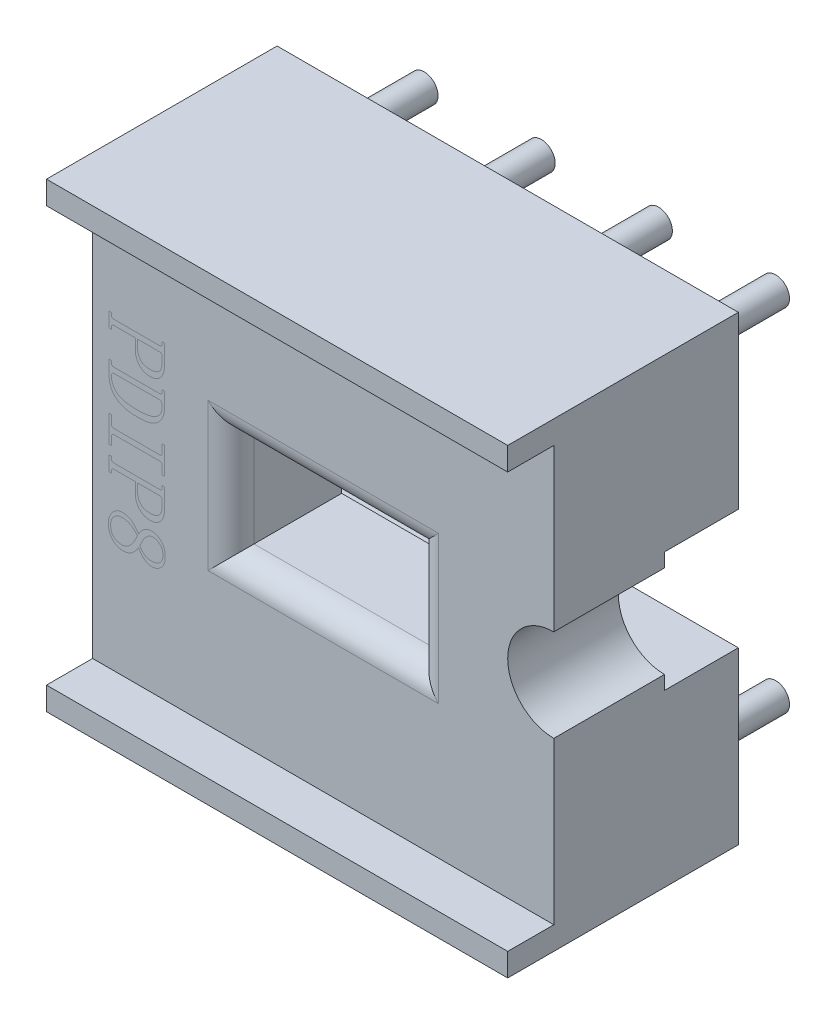
from build123d import *

# Parameters (mm, degrees)
EXTRUDE_1_DEPTH     = 5
SKETCH_2_W          = 1
SKETCH_2_H          = 9
SKETCH_2_W_2        = 1.6
SKETCH_2_H_2        = 2.6
CUT_EXTRUDE_1_DEPTH = 16
CUT_EXTRUDE_2_REACH = 16.697
SKETCH_3_W          = 4
SKETCH_3_H          = 2.2
SKETCH_4_R          = 0.3
EXTRUDE_2_DEPTH     = 2
FILLET_1_R          = 0.5


with BuildPart() as part:
    # 草图1 → 凸台-拉伸1 (new body)
    with BuildSketch(Plane.XY):
        with BuildLine():
            Line((0, 0), (10, 0))
            Line((10, 0), (10, 4))
            ThreePointArc((10, 4), (9, 5), (10, 6))
            Line((10, 6), (10, 10))
            Line((10, 10), (0, 10))
            Line((0, 10), (0, 0))
        make_face()
    extrude(amount=EXTRUDE_1_DEPTH)

    # 草图2 → 切除-拉伸1 (cut, through all)
    with BuildSketch(Plane(origin=(10, 0, 0), x_dir=(0, 0, -1), z_dir=(1, 0, 0))):
        with Locations((-4.5, 5)):
            Rectangle(SKETCH_2_W, SKETCH_2_H)
        with Locations((-0.8, 5)):
            Rectangle(SKETCH_2_W_2, SKETCH_2_H_2)
    extrude(amount=-CUT_EXTRUDE_1_DEPTH, mode=Mode.SUBTRACT)

    # 草图3 → 切除-拉伸2 (cut, up to next)
    with BuildSketch(Plane.XY.offset(4), mode=Mode.PRIVATE) as cut_extrude_2_sk1:
        with Locations((5, 5)):
            Rectangle(SKETCH_3_W, SKETCH_3_H)
    cut_extrude_2_tool1 = extrude(cut_extrude_2_sk1.sketch, amount=-CUT_EXTRUDE_2_REACH, mode=Mode.PRIVATE) & part.part
    add(cut_extrude_2_tool1.solids().sort_by_distance((5, 5, 4))[0], mode=Mode.SUBTRACT)

    # 草图4 → 凸台-拉伸2 (add)
    with BuildSketch(Plane(origin=(0, 0, 0), x_dir=(-1, 0, 0), z_dir=(0, 0, -1))):
        with Locations((-3.73, 8.81)):
            Circle(SKETCH_4_R)
        with Locations((-1.19, 8.81)):
            Circle(SKETCH_4_R)
        with Locations((-6.27, 8.81)):
            Circle(SKETCH_4_R)
        with Locations((-8.81, 8.81)):
            Circle(SKETCH_4_R)
        with Locations((-8.81, 1.19)):
            Circle(SKETCH_4_R)
        with Locations((-6.27, 1.19)):
            Circle(SKETCH_4_R)
        with Locations((-3.73, 1.19)):
            Circle(SKETCH_4_R)
        with Locations((-1.19, 1.19)):
            Circle(SKETCH_4_R)
    extrude(amount=EXTRUDE_2_DEPTH)

    # 圆角1
    fillet_1_edges = [part.edges().sort_by_distance(p)[0] for p in [
        (3, 5, 4),
        (5, 3.9, 4),
        (7, 5, 4),
        (5, 6.1, 4),
    ]]
    fillet(fillet_1_edges, radius=FILLET_1_R)


solid = part.part
